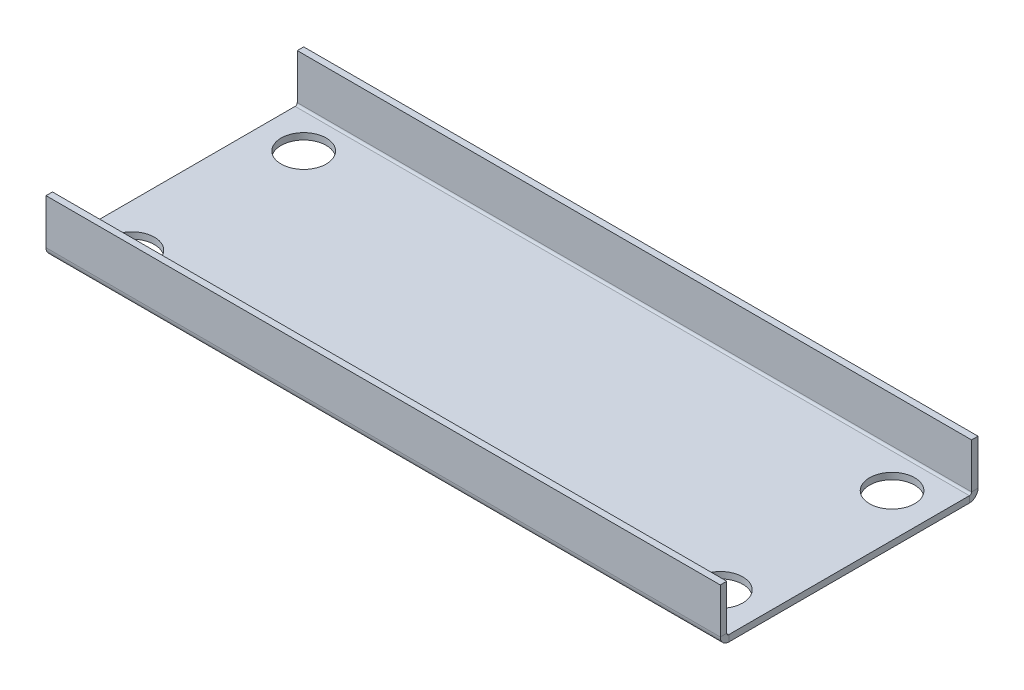
from build123d import *

# Parameters (mm, degrees)
SKETCH1_W                      = 314
SKETCH1_H                      = 114
BOSS_EXTRUDE1_DEPTH            = 3
EDGE_FLANGE1_STRIP_W           = 14
EDGE_FLANGE1_STRIP_H           = 3
EDGE_FLANGE1_STRIP_CUT_DEPTH   = 314
EDGE_FLANGE1_STRIP_2_W         = 14
EDGE_FLANGE1_STRIP_2_H         = 3
EDGE_FLANGE1_STRIP_CUT_2_DEPTH = 314
EDGE_FLANGE1_DEPTH             = 314
EDGE_FLANGE1_BEND_DEPTH        = 314
CUT_EXTRUDE1_REACH             = 171.924
SKETCH16_R                     = 10.5


# Sheet-metal steps are written as plain solids
with BuildPart() as part:
    # Sketch1 → Boss-Extrude1 (new body)
    with BuildSketch(Plane(origin=(0, 0, 0), x_dir=(1, 0, 0), z_dir=(0, 1, 0))):
        Rectangle(SKETCH1_W, SKETCH1_H)
    extrude(amount=BOSS_EXTRUDE1_DEPTH)

    # Edge-Flange1 strip (across the edge) → Edge-Flange1 strip cut (cut)
    with BuildSketch(Plane(origin=(-157, 3, 57), x_dir=(0, 0, -1), z_dir=(1, 0, 0))):
        with Locations((-6, -1.5)):
            Rectangle(EDGE_FLANGE1_STRIP_W, EDGE_FLANGE1_STRIP_H)
    extrude(amount=EDGE_FLANGE1_STRIP_CUT_DEPTH, mode=Mode.SUBTRACT)

    # Edge-Flange1 strip 2 (across the edge) → Edge-Flange1 strip cut 2 (cut)
    with BuildSketch(Plane(origin=(157, 3, -57), x_dir=(0, 0, 1), z_dir=(-1, 0, 0))):
        with Locations((-6, -1.5)):
            Rectangle(EDGE_FLANGE1_STRIP_2_W, EDGE_FLANGE1_STRIP_2_H)
    extrude(amount=EDGE_FLANGE1_STRIP_CUT_2_DEPTH, mode=Mode.SUBTRACT)

    # Edge-Flange1 section (across the edge) → Edge-Flange1 (add)
    with BuildSketch(Plane(origin=(-157, 3, 57), x_dir=(0, 0, -1), z_dir=(1, 0, 0))):
        with BuildLine():
            Line((-3, 1), (-3, 22))
            Line((-3, 22), (0, 22))
            Line((0, 22), (0, 1))
            ThreePointArc((0, 1), (0.292893219, 0.292893219), (1, 0))
            Line((1, 0), (1, -3))
            ThreePointArc((1, -3), (-1.828427125, -1.828427125), (-3, 1))
        make_face()
    extrude(amount=EDGE_FLANGE1_DEPTH)

    # Edge-Flange1 section 2 (across the edge) → Edge-Flange1 bend (add)
    with BuildSketch(Plane(origin=(157, 3, -57), x_dir=(0, 0, 1), z_dir=(-1, 0, 0))):
        with BuildLine():
            Line((-3, 1), (-3, 22))
            Line((-3, 22), (0, 22))
            Line((0, 22), (0, 1))
            ThreePointArc((0, 1), (0.292893219, 0.292893219), (1, 0))
            Line((1, 0), (1, -3))
            ThreePointArc((1, -3), (-1.828427125, -1.828427125), (-3, 1))
        make_face()
    extrude(amount=EDGE_FLANGE1_BEND_DEPTH)

    # Sketch16 → Cut-Extrude1 (cut, up to next)
    with BuildSketch(Plane.XZ, mode=Mode.PRIVATE) as cut_extrude1_sk1:
        with Locations(Location((-137, 40, 0), (0, 0, 270))):
            Circle(SKETCH16_R)
    cut_extrude1_tool1 = extrude(cut_extrude1_sk1.sketch, amount=-CUT_EXTRUDE1_REACH, mode=Mode.PRIVATE) & part.part
    # Sketch16 → Cut-Extrude1 (cut, up to next)
    with BuildSketch(Plane.XZ, mode=Mode.PRIVATE) as cut_extrude1_sk2:
        with Locations(Location((-137, -40, 0), (0, 0, 270))):
            Circle(SKETCH16_R)
    cut_extrude1_tool2 = extrude(cut_extrude1_sk2.sketch, amount=-CUT_EXTRUDE1_REACH, mode=Mode.PRIVATE) & part.part
    # Sketch16 → Cut-Extrude1 (cut, up to next)
    with BuildSketch(Plane.XZ, mode=Mode.PRIVATE) as cut_extrude1_sk3:
        with Locations(Location((137, -40, 0), (0, 0, 270))):
            Circle(SKETCH16_R)
    cut_extrude1_tool3 = extrude(cut_extrude1_sk3.sketch, amount=-CUT_EXTRUDE1_REACH, mode=Mode.PRIVATE) & part.part
    # Sketch16 → Cut-Extrude1 (cut, up to next)
    with BuildSketch(Plane.XZ, mode=Mode.PRIVATE) as cut_extrude1_sk4:
        with Locations(Location((137, 40, 0), (0, 0, 270))):
            Circle(SKETCH16_R)
    cut_extrude1_tool4 = extrude(cut_extrude1_sk4.sketch, amount=-CUT_EXTRUDE1_REACH, mode=Mode.PRIVATE) & part.part
    add(cut_extrude1_tool1.solids().sort_by_distance((-137, 0, 40))[0], mode=Mode.SUBTRACT)
    add(cut_extrude1_tool2.solids().sort_by_distance((-137, 0, -40))[0], mode=Mode.SUBTRACT)
    add(cut_extrude1_tool3.solids().sort_by_distance((137, 0, -40))[0], mode=Mode.SUBTRACT)
    add(cut_extrude1_tool4.solids().sort_by_distance((137, 0, 40))[0], mode=Mode.SUBTRACT)


solid = part.part
